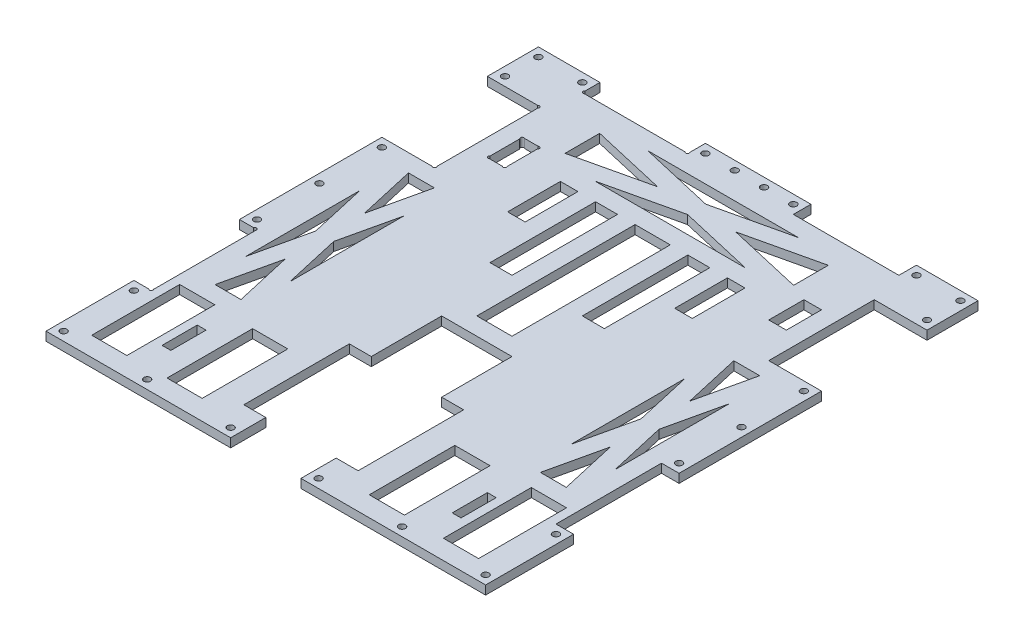
from build123d import *

# Parameters (mm, degrees)
SKETCH1_W           = 317.5
SKETCH1_H           = 355.6
BOSS_EXTRUDE1_DEPTH = 6.35
SKETCH2_W           = 50.8
SKETCH2_H           = 152.4
CUT_EXTRUDE1_DEPTH  = 239.442288615
SKETCH3_W           = 25.4
SKETCH3_H           = 76.2
SKETCH3_W_2         = 12.7
SKETCH3_H_2         = 25.4
CUT_EXTRUDE2_DEPTH  = 239.442288615
SKETCH4_W           = 12.7
SKETCH4_H           = 76.2
SKETCH4_W_2         = 76.2
SKETCH4_H_2         = 12.7
SKETCH4_W_3         = 15.875
CUT_EXTRUDE3_DEPTH  = 239.442288615
SKETCH5_W           = 25.4
SKETCH5_H           = 61.819423232
SKETCH5_H_2         = 114.3
SKETCH5_W_2         = 12.7
SKETCH5_H_3         = 38.1
SKETCH5_H_4         = 63.5
SKETCH5_W_3         = 6.35
SKETCH5_H_5         = 25.4
CUT_EXTRUDE4_DEPTH  = 239.442288615
SKETCH7_R           = 2.413
CUT_EXTRUDE6_DEPTH  = 239.442288615
SKETCH8_R           = 1.27
CUT_EXTRUDE7_DEPTH  = 239.442288615


with BuildPart() as part:
    # Sketch1 → Boss-Extrude1 (new body)
    with BuildSketch(Plane(origin=(0, 0, 0), x_dir=(1, 0, 0), z_dir=(0, 1, 0))):
        Rectangle(SKETCH1_W, SKETCH1_H)
    extrude(amount=BOSS_EXTRUDE1_DEPTH)

    # Sketch2 → Cut-Extrude1 (cut, through all)
    with BuildSketch(Plane(origin=(0, 6.35, 0), x_dir=(1, 0, 0), z_dir=(0, 1, 0))):
        with Locations((0, -101.6)):
            Rectangle(SKETCH2_W, SKETCH2_H)
    extrude(amount=-CUT_EXTRUDE1_DEPTH, mode=Mode.SUBTRACT)

    # Sketch3 → Cut-Extrude2 (cut, through all)
    with BuildSketch(Plane(origin=(0, 6.35, 0), x_dir=(1, 0, 0), z_dir=(0, 1, 0))):
        with Locations((133.35, 102.87)):
            Rectangle(SKETCH3_W, SKETCH3_H)
        with Locations((101.6, 102.87)):
            Rectangle(SKETCH3_W_2, SKETCH3_H_2)
        with Locations((-101.6, 102.87)):
            Rectangle(SKETCH3_W_2, SKETCH3_H_2)
        with Locations((-133.35, 102.87)):
            Rectangle(SKETCH3_W, SKETCH3_H)
    extrude(amount=-CUT_EXTRUDE2_DEPTH, mode=Mode.SUBTRACT)

    # Sketch4 → Cut-Extrude3 (cut, through all)
    with BuildSketch(Plane(origin=(0, 6.35, 0), x_dir=(1, 0, 0), z_dir=(0, 1, 0))):
        with Locations((-152.4, 102.87)):
            Rectangle(SKETCH4_W, SKETCH4_H)
        with Locations((-152.4, -76.2)):
            Rectangle(SKETCH4_W, SKETCH4_H)
        with Locations((152.4, 102.87)):
            Rectangle(SKETCH4_W, SKETCH4_H)
        with Locations((152.4, -76.2)):
            Rectangle(SKETCH4_W, SKETCH4_H)
        with Locations((76.2, 171.45)):
            Rectangle(SKETCH4_W_2, SKETCH4_H_2)
        with Locations((-76.2, 171.45)):
            Rectangle(SKETCH4_W_2, SKETCH4_H_2)
        with Locations((-33.3375, -114.3)):
            Rectangle(SKETCH4_W_3, SKETCH4_H)
        with Locations((33.3375, 63.5)):
            Rectangle(SKETCH4_W_3, SKETCH4_H)
        with Locations((-33.3375, 63.5)):
            Rectangle(SKETCH4_W_3, SKETCH4_H)
        with Locations((33.3375, -114.3)):
            Rectangle(SKETCH4_W_3, SKETCH4_H)
    extrude(amount=-CUT_EXTRUDE3_DEPTH, mode=Mode.SUBTRACT)

    # Sketch5 → Cut-Extrude4 (cut, through all)
    with BuildSketch(Plane(origin=(0, 6.35, 0), x_dir=(1, 0, 0), z_dir=(0, 1, 0))):
        with Locations((-73.025, -132.509711616)):
            Rectangle(SKETCH5_W, SKETCH5_H)
        Polygon((-117.475, -46.432505999), (-126.838066818, -87.63), (-108.111933182, -87.63), align=None)
        Polygon((-133.35, 23.417494001), (-133.35, -58.977494001), (-123.986933182, -17.78), align=None)
        Polygon((-101.6, 23.417494001), (-110.963066818, -17.78), (-101.6, -58.977494001), align=None)
        Polygon((-126.838066818, 52.07), (-117.475, 10.872505999), (-108.111933182, 52.07), align=None)
        Polygon((0, 126.833110246), (-54.310144398, 114.3), (54.310144398, 114.3), align=None)
        Polygon((-82.55, 145.883110246), (-82.55, 120.816889754), (-28.239855602, 133.35), align=None)
        Polygon((82.55, 145.883110246), (28.239855602, 133.35), (82.55, 120.816889754), align=None)
        Polygon((-54.310144398, 152.4), (0, 139.866889754), (54.310144398, 152.4), align=None)
        with Locations((0, 44.45)):
            Rectangle(SKETCH5_W, SKETCH5_H_2)
        with Locations((-60.325, 82.55)):
            Rectangle(SKETCH5_W_2, SKETCH5_H_3)
        with Locations((60.325, 82.55)):
            Rectangle(SKETCH5_W_2, SKETCH5_H_3)
        with Locations((-127, -132.08)):
            Rectangle(SKETCH5_W, SKETCH5_H_4)
        with Locations((-104.775, -132.08)):
            Rectangle(SKETCH5_W_3, SKETCH5_H_5)
    cut_extrude4 = extrude(amount=-CUT_EXTRUDE4_DEPTH, mode=Mode.SUBTRACT)

    # Mirror1: Cut-Extrude4 across plane
    add(cut_extrude4.mirror(Plane(origin=(0, 0, 0), x_dir=(0, 0, 1), z_dir=(1, 0, 0))), mode=Mode.SUBTRACT)

    # Sketch7 → Cut-Extrude6 (cut, through all)
    with BuildSketch(Plane(origin=(0, 6.35, 0), x_dir=(1, 0, 0), z_dir=(0, 1, 0))):
        with Locations((-152.4, -171.45)):
            Circle(SKETCH7_R)
        with Locations((-152.4, 171.45)):
            Circle(SKETCH7_R)
        with Locations((-120.65, 171.45)):
            Circle(SKETCH7_R)
        with Locations((-152.4, 147.32)):
            Circle(SKETCH7_R)
        with Locations((-31.75, 171.45)):
            Circle(SKETCH7_R)
        with Locations((-10.583333333, 171.45)):
            Circle(SKETCH7_R)
        with Locations((10.583333333, 171.45)):
            Circle(SKETCH7_R)
        with Locations((31.75, 171.45)):
            Circle(SKETCH7_R)
        with Locations((-31.75, -171.45)):
            Circle(SKETCH7_R)
        with Locations((-92.075, -171.45)):
            Circle(SKETCH7_R)
        with Locations((-152.4, -120.65)):
            Circle(SKETCH7_R)
        with Locations((-152.4, -31.75)):
            Circle(SKETCH7_R)
        with Locations((-152.4, 58.42)):
            Circle(SKETCH7_R)
        with Locations((-152.4, 13.335)):
            Circle(SKETCH7_R)
        with Locations((31.75, -171.45)):
            Circle(SKETCH7_R)
        with Locations((152.4, 13.335)):
            Circle(SKETCH7_R)
        with Locations((152.4, 58.42)):
            Circle(SKETCH7_R)
        with Locations((152.4, -31.75)):
            Circle(SKETCH7_R)
        with Locations((152.4, -120.65)):
            Circle(SKETCH7_R)
        with Locations((92.075, -171.45)):
            Circle(SKETCH7_R)
        with Locations((152.4, 147.32)):
            Circle(SKETCH7_R)
        with Locations((120.65, 171.45)):
            Circle(SKETCH7_R)
        with Locations((152.4, 171.45)):
            Circle(SKETCH7_R)
        with Locations((152.4, -171.45)):
            Circle(SKETCH7_R)
    extrude(amount=-CUT_EXTRUDE6_DEPTH, mode=Mode.SUBTRACT)

    # Sketch8 → Cut-Extrude7 (cut, through all)
    with BuildSketch(Plane(origin=(0, 6.35, 0), x_dir=(1, 0, 0), z_dir=(0, 1, 0))):
        with Locations((-39.09938383, 165.88366572)):
            Circle(SKETCH8_R)
        with Locations((-113.539841326, 166.117378391)):
            Circle(SKETCH8_R)
        with Locations((-121.560019166, 140.084130304)):
            Circle(SKETCH8_R)
        with Locations((-121.565556473, 65.650145639)):
            Circle(SKETCH8_R)
        with Locations((-147.253032713, -38.506954901)):
            Circle(SKETCH8_R)
        with Locations((-147.044413998, -113.510037468)):
            Circle(SKETCH8_R)
        with Locations((-107.194291917, 114.549311364)):
            Circle(SKETCH8_R)
        with Locations((-96.034081321, 114.570942203)):
            Circle(SKETCH8_R)
        with Locations((-107.184450657, 91.18332828)):
            Circle(SKETCH8_R)
        with Locations((-96.208355861, 91.003339093)):
            Circle(SKETCH8_R)
    extrude(amount=-CUT_EXTRUDE7_DEPTH, mode=Mode.SUBTRACT)


solid = part.part
